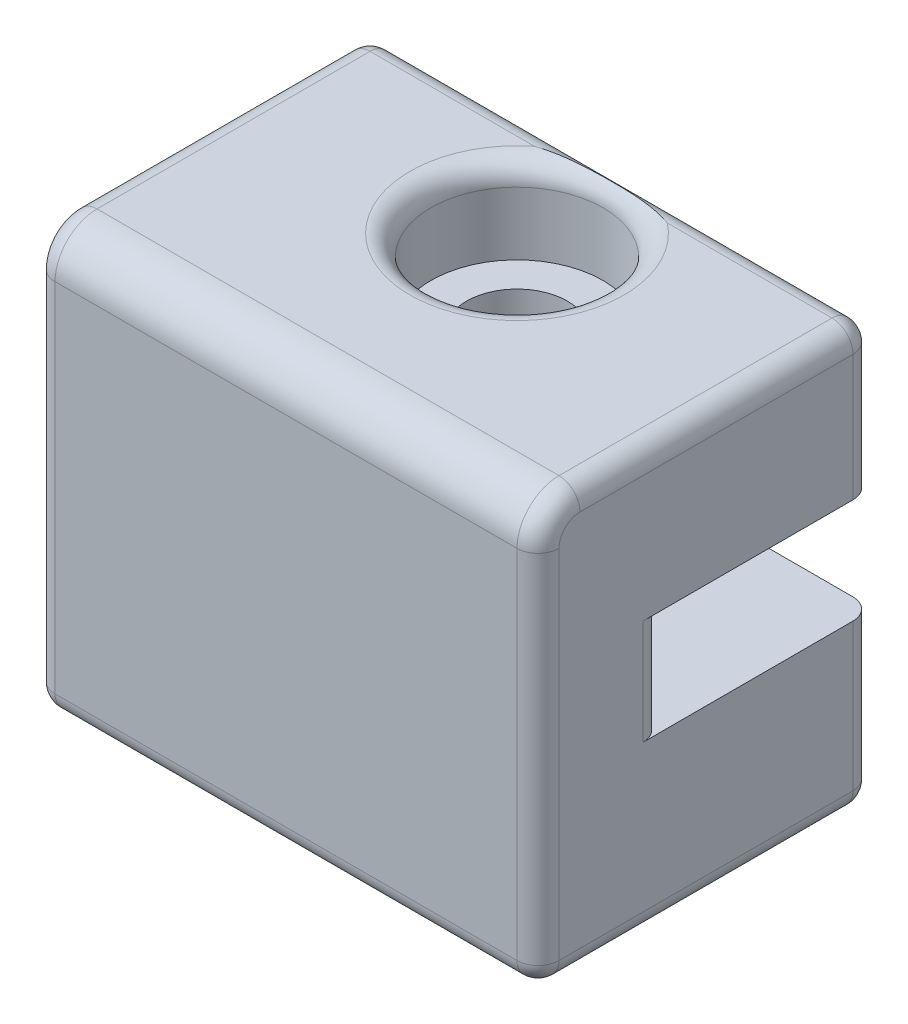
from build123d import *

# Parameters (mm, degrees)
SKETCH1_W               = 12
SKETCH1_H               = 5
BOSS_EXTRUDE1_DEPTH     = 4
SKETCH2_W               = 12
SKETCH2_H               = 6.5
BOSS_EXTRUDE2_DEPTH     = 3
SKETCH3_W               = 12
SKETCH3_H               = 8
BOSS_EXTRUDE3_DEPTH     = 3.5
CUT_EXTRUDE1_DEPTH      = 7
CUT_EXTRUDE1_DEPTH_BACK = 5
SKETCH4_R               = 1.2
SKETCH5_R               = 2.05
CUT_EXTRUDE2_DEPTH      = 2
FILLET3_R               = 0.5
FILLET6_R               = 1
FILLET7_R               = 0.5


with BuildPart() as part:
    # Sketch1 → Boss-Extrude1 (new body)
    with BuildSketch(Plane(origin=(0, 0, 0), x_dir=(1, 0, 0), z_dir=(0, 1, 0))):
        Rectangle(SKETCH1_W, SKETCH1_H)
    extrude(amount=BOSS_EXTRUDE1_DEPTH)

    # Sketch2 → Boss-Extrude2 (add)
    with BuildSketch(Plane.XY.offset(2.5)):
        with Locations((0, 3.25)):
            Rectangle(SKETCH2_W, SKETCH2_H)
    extrude(amount=BOSS_EXTRUDE2_DEPTH)

    # Sketch3 → Boss-Extrude3 (add)
    with BuildSketch(Plane(origin=(0, 6.5, 0), x_dir=(1, 0, 0), z_dir=(0, 1, 0))):
        with Locations((0, -1.5)):
            Rectangle(SKETCH3_W, SKETCH3_H)
    extrude(amount=BOSS_EXTRUDE3_DEPTH)

    # Sketch4 → Cut-Extrude1 (cut, two sides: drawn at the far end of the back side and taken through both)
    with BuildSketch(Plane(origin=(0, 4, 0), x_dir=(1, 0, 0), z_dir=(0, 1, 0)).offset(-CUT_EXTRUDE1_DEPTH_BACK)):
        with Locations(Location((0, 0, 0), (0, 0, 90))):
            Circle(SKETCH4_R)
    extrude(amount=CUT_EXTRUDE1_DEPTH + CUT_EXTRUDE1_DEPTH_BACK, mode=Mode.SUBTRACT)

    # Sketch5 → Cut-Extrude2 (cut)
    with BuildSketch(Plane(origin=(0, 10, 0), x_dir=(1, 0, 0), z_dir=(0, 1, 0))):
        with Locations(Location((0, 0, 0), (0, 0, 270))):
            Circle(SKETCH5_R)
    extrude(amount=-CUT_EXTRUDE2_DEPTH, mode=Mode.SUBTRACT)

    # Fillet3
    fillet3_edges = [part.edges().sort_by_distance(p)[0] for p in [
        (-6, 5.25, 2.5),
        (6, 5.25, 2.5),
        (0, 0, 5.5),
        (-6, 0, 1.5),
        (0, 0, -2.5),
        (6, 0, 1.5),
        (-6, 2, -2.5),
        (6, 2, -2.5),
    ]]
    fillet(fillet3_edges, radius=FILLET3_R)

    # Fillet6
    fillet6_edges = [part.edges().sort_by_distance(p)[0] for p in [
        (0, 10, 5.5),
    ]]
    fillet(fillet6_edges, radius=FILLET6_R)

    # Fillet7
    # the kernel refuses this fillet: 0.5 mm, written as the material it takes off along each edge
    with BuildSketch(Plane(origin=(5.5, 0.5, 5), x_dir=(0, 0, 1), z_dir=(1, 0, 0))) as fillet7_piece_1_section:
        Polygon((0, 0), (FILLET7_R, 0), (FILLET7_R, FILLET7_R), (0, FILLET7_R), align=None)
    fillet7_piece_1 = extrude(amount=FILLET7_R, mode=Mode.PRIVATE)
    fillet7_piece_1 = fillet7_piece_1 - Plane(origin=(5.5, 0.5, 5), x_dir=(0, 0.7071067811865475, -0.7071067811865475), z_dir=(1, 0, 0)) * Sphere(FILLET7_R, mode=Mode.PRIVATE)
    add(fillet7_piece_1, mode=Mode.SUBTRACT)
    with BuildSketch(Plane(origin=(-5.5, 0.5, 5), x_dir=(-1, 0, 0), z_dir=(0, 0, 1))) as fillet7_piece_2_section:
        Polygon((0, 0), (FILLET7_R, 0), (FILLET7_R, FILLET7_R), (0, FILLET7_R), align=None)
    fillet7_piece_2 = extrude(amount=FILLET7_R, mode=Mode.PRIVATE)
    fillet7_piece_2 = fillet7_piece_2 - Plane(origin=(-5.5, 0.5, 5), x_dir=(0.7071067811865475, 0.7071067811865475, 0), z_dir=(0, 0, 1)) * Sphere(FILLET7_R, mode=Mode.PRIVATE)
    add(fillet7_piece_2, mode=Mode.SUBTRACT)
    with BuildSketch(Plane(origin=(5.5, 9.5, -2), x_dir=(0, 1, 0), z_dir=(1, 0, 0))) as fillet7_piece_3_section:
        Polygon((0, 0), (FILLET7_R, 0), (FILLET7_R, -FILLET7_R), (0, -FILLET7_R), align=None)
    fillet7_piece_3 = extrude(amount=FILLET7_R, mode=Mode.PRIVATE)
    fillet7_piece_3 = fillet7_piece_3 - Plane(origin=(5.5, 9.5, -2), x_dir=(0, -0.7071067811865475, 0.7071067811865475), z_dir=(1, 0, 0)) * Sphere(FILLET7_R, mode=Mode.PRIVATE)
    add(fillet7_piece_3, mode=Mode.SUBTRACT)
    with BuildSketch(Plane(origin=(-5.5, 9.5, -2), x_dir=(0, 1, 0), z_dir=(-1, 0, 0))) as fillet7_piece_4_section:
        Polygon((0, 0), (FILLET7_R, 0), (FILLET7_R, FILLET7_R), (0, FILLET7_R), align=None)
    fillet7_piece_4 = extrude(amount=FILLET7_R, mode=Mode.PRIVATE)
    fillet7_piece_4 = fillet7_piece_4 - Plane(origin=(-5.5, 9.5, -2), x_dir=(0, -0.7071067811865475, 0.7071067811865475), z_dir=(-1, 0, 0)) * Sphere(FILLET7_R, mode=Mode.PRIVATE)
    add(fillet7_piece_4, mode=Mode.SUBTRACT)
    with BuildSketch(Plane(origin=(6, 10, 4.5), x_dir=(0, -1, 0), z_dir=(0, 0, -1))) as fillet7_piece_5:
        with BuildLine():
            CenterArc((FILLET7_R, FILLET7_R), FILLET7_R, 180, 90)
            Line((0, FILLET7_R), (0, 0))
            Line((0, 0), (FILLET7_R, 0))
        make_face()
    extrude(amount=6.5, mode=Mode.SUBTRACT)
    with BuildSketch(Plane(origin=(6, 9, 4.5), x_dir=(0, 1, 0), z_dir=(0, 0, -1))) as fillet7_piece_6:
        with BuildLine():
            CenterArc((1 - FILLET7_R, -FILLET7_R), FILLET7_R, 0, 90)
            Line((1, -FILLET7_R), (1, 0))
            Line((1, 0), (1 - FILLET7_R, 0))
        make_face()
    revolve(axis=Axis((6, 9, 4.5), (1, 0, 0)), revolution_arc=90, mode=Mode.SUBTRACT)
    with BuildSketch(Plane(origin=(-6, 9, 5.5), x_dir=(1, 0, 0), z_dir=(0, -1, 0)), Plane(origin=(6, 9, 5.5), x_dir=(0, 0, -1), z_dir=(0, -1, 0))) as fillet7_piece_7:
        with BuildLine():
            CenterArc((FILLET7_R, -FILLET7_R), FILLET7_R, 90, 90)
            Line((0, -FILLET7_R), (0, 0))
            Line((0, 0), (FILLET7_R, 0))
        make_face()
    extrude(amount=8.5, mode=Mode.SUBTRACT)
    with BuildSketch(Plane(origin=(-6, 9, 4.5), x_dir=(0, 1, 0), z_dir=(0, 0, -1))) as fillet7_piece_8:
        with BuildLine():
            CenterArc((1 - FILLET7_R, FILLET7_R), FILLET7_R, 270, 90)
            Line((1 - FILLET7_R, 0), (1, 0))
            Line((1, 0), (1, FILLET7_R))
        make_face()
    revolve(axis=Axis((-6, 9, 4.5), (1, 0, 0)), revolution_arc=90, mode=Mode.SUBTRACT)
    with BuildSketch(Plane(origin=(-6, 5.25, -2.5), x_dir=(1, 0, 0), z_dir=(0, 1, 0)), Plane(origin=(6, 5.25, -2.5), x_dir=(0, 0, 1), z_dir=(0, 1, 0))) as fillet7_piece_9:
        with BuildLine():
            CenterArc((FILLET7_R, -FILLET7_R), FILLET7_R, 90, 90)
            Line((0, -FILLET7_R), (0, 0))
            Line((0, 0), (FILLET7_R, 0))
        make_face()
    extrude(amount=4.25, mode=Mode.SUBTRACT)
    with BuildSketch(Plane(origin=(-6, 10, -2), x_dir=(1, 0, 0), z_dir=(0, 0, 1))) as fillet7_piece_10:
        with BuildLine():
            CenterArc((FILLET7_R, -FILLET7_R), FILLET7_R, 90, 90)
            Line((0, -FILLET7_R), (0, 0))
            Line((0, 0), (FILLET7_R, 0))
        make_face()
    extrude(amount=6.5, mode=Mode.SUBTRACT)
    with BuildSketch(Plane(origin=(5.5, 10, -2.5), x_dir=(0, 0, 1), z_dir=(-1, 0, 0))) as fillet7_piece_11:
        with BuildLine():
            CenterArc((FILLET7_R, -FILLET7_R), FILLET7_R, 90, 90)
            Line((0, -FILLET7_R), (0, 0))
            Line((0, 0), (FILLET7_R, 0))
        make_face()
    extrude(amount=11, mode=Mode.SUBTRACT)
    with BuildSketch(Plane(origin=(0, 10, 0), x_dir=(0, 0, 1), z_dir=(-1, 0, 0))) as fillet7_piece_12:
        with BuildLine():
            CenterArc((2.05 + FILLET7_R, -FILLET7_R), FILLET7_R, 90, 90)
            Line((2.05, -FILLET7_R), (2.05, 0))
            Line((2.05, 0), (2.05 + FILLET7_R, 0))
        make_face()
    revolve(axis=Axis((0, 10, 0), (0, 1, 0)), mode=Mode.SUBTRACT)


solid = part.part
